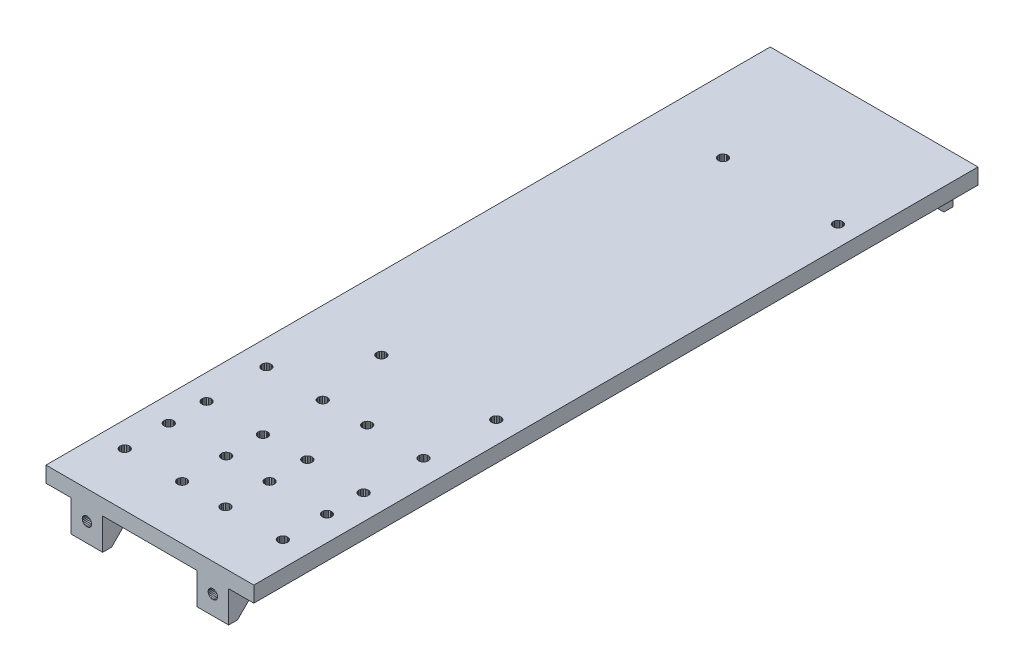
from build123d import *

# Parameters (mm, degrees)
SKETCH1_W           = 65.999999642
SKETCH1_H           = 229.999999516
BOSS_EXTRUDE1_DEPTH = 4.999999888
CUT_EXTRUDE1_DEPTH  = 238.358378211
CUT_EXTRUDE2_DEPTH  = 238.358378211
CUT_EXTRUDE3_DEPTH  = 238.358378211
CUT_EXTRUDE4_DEPTH  = 238.358378211
CUT_EXTRUDE5_DEPTH  = 238.358378211
CUT_EXTRUDE6_DEPTH  = 238.358378211
CUT_EXTRUDE7_DEPTH  = 238.358378211
CUT_EXTRUDE8_DEPTH  = 238.358378211
CUT_EXTRUDE9_DEPTH  = 238.358378211
CUT_EXTRUDE10_DEPTH = 238.358378211
CUT_EXTRUDE11_DEPTH = 238.358378211
CUT_EXTRUDE12_DEPTH = 238.358378211
CUT_EXTRUDE13_DEPTH = 238.358378211
CUT_EXTRUDE14_DEPTH = 238.358378211
CUT_EXTRUDE15_DEPTH = 238.358378211
CUT_EXTRUDE16_DEPTH = 238.358378211
CUT_EXTRUDE17_DEPTH = 238.358378211
CUT_EXTRUDE18_DEPTH = 238.358378211
CUT_EXTRUDE19_DEPTH = 238.358378211
SKETCH21_W          = 10.000000708
SKETCH21_H          = 10.000005364
BOSS_EXTRUDE2_DEPTH = 9.999999776
CUT_EXTRUDE20_DEPTH = 223.966359357
SKETCH23_W          = 10.000000708
SKETCH23_H          = 9.999999777
BOSS_EXTRUDE3_DEPTH = 9.999999776
CUT_EXTRUDE21_DEPTH = 223.96636487
SKETCH25_W          = 10.000000708
SKETCH25_H          = 10.000005364
BOSS_EXTRUDE4_DEPTH = 9.999999776
CUT_EXTRUDE22_DEPTH = 223.966359357
CUT_EXTRUDE23_DEPTH = 238.516314605
SKETCH28_W          = 10.000000708
SKETCH28_H          = 9.999999777
BOSS_EXTRUDE5_DEPTH = 9.999999776
CUT_EXTRUDE24_REACH = 234.839
CUT_EXTRUDE25_DEPTH = 243.515978303
CUT_EXTRUDE26_DEPTH = 243.515978303


with BuildPart() as part:
    # Sketch1 → Boss-Extrude1 (new body)
    with BuildSketch(Plane(origin=(0, 0, 0), x_dir=(1, 0, 0), z_dir=(0, 1, 0))):
        with Locations((0, -119.999999646)):
            Rectangle(SKETCH1_W, SKETCH1_H)
    extrude(amount=-BOSS_EXTRUDE1_DEPTH)

    # Sketch2 → Cut-Extrude1 (cut, through all)
    with BuildSketch(Plane.XZ.offset(4.999999888)):
        Polygon((-8.432590403, 192.175418139), (-8.38147942, 191.787183285), (-8.231628686, 191.425412893), (-7.993251085, 191.114768386), (-7.682590745, 190.876379609), (-7.320819888, 190.726533532), (-6.932591554, 190.675407648), (-6.544363685, 190.726533532), (-6.182592362, 190.876379609), (-5.871932488, 191.114768386), (-5.633554887, 191.425412893), (-5.483704153, 191.787183285), (-5.432592705, 192.175418139), (-5.483704153, 192.563638091), (-5.633554887, 192.925408483), (-5.871932488, 193.236067891), (-6.182592362, 193.474456668), (-6.544363685, 193.624302745), (-6.932591554, 193.675413728), (-7.320819888, 193.624302745), (-7.682590745, 193.474456668), (-7.993251085, 193.236067891), (-8.231628686, 192.925408483), (-8.38147942, 192.563638091), align=None)
    extrude(amount=-CUT_EXTRUDE1_DEPTH, mode=Mode.SUBTRACT)

    # Sketch3 → Cut-Extrude2 (cut, through all)
    with BuildSketch(Plane.XZ.offset(4.999999888)):
        Polygon((-8.373498917, 203.901484609), (-8.322387934, 203.513264656), (-8.172538131, 203.151494265), (-7.934159599, 202.840834856), (-7.623499259, 202.602446079), (-7.261727937, 202.452600002), (-6.873499602, 202.401489019), (-6.485270336, 202.452600002), (-6.123499479, 202.602446079), (-5.812839139, 202.840834856), (-5.574461073, 203.151494265), (-5.424610805, 203.513264656), (-5.373499356, 203.901484609), (-5.424610805, 204.289719462), (-5.574461073, 204.651489854), (-5.812839139, 204.962149262), (-6.123499479, 205.200538039), (-6.485270336, 205.350369215), (-6.873499602, 205.401495099), (-7.261727937, 205.350369215), (-7.623499259, 205.200538039), (-7.934159599, 204.962149262), (-8.172538131, 204.651489854), (-8.322387934, 204.289719462), align=None)
    extrude(amount=-CUT_EXTRUDE2_DEPTH, mode=Mode.SUBTRACT)

    # Sketch4 → Cut-Extrude3 (cut, through all)
    with BuildSketch(Plane.XZ.offset(4.999999888)):
        Polygon((-26.448886842, 191.611766815), (-26.299037039, 191.249996424), (-26.060659438, 190.939351916), (-25.75000003, 190.700978041), (-25.388229638, 190.551117063), (-25.000000373, 190.50000608), (-24.611772969, 190.551117063), (-24.250002578, 190.700978041), (-23.939341307, 190.939351916), (-23.700963706, 191.249996424), (-23.551113904, 191.611766815), (-23.500001058, 192.000001669), (-23.551113904, 192.388236523), (-23.700963706, 192.750006914), (-23.939341307, 193.060666323), (-24.250002578, 193.299040198), (-24.611772969, 193.448886275), (-25.000000373, 193.499997258), (-25.388229638, 193.448886275), (-25.75000003, 193.299040198), (-26.060659438, 193.060666323), (-26.299037039, 192.750006914), (-26.448886842, 192.388236523), (-26.499997824, 192.000001669), align=None)
    extrude(amount=-CUT_EXTRUDE3_DEPTH, mode=Mode.SUBTRACT)

    # Sketch5 → Cut-Extrude4 (cut, through all)
    with BuildSketch(Plane.XZ.offset(4.999999888)):
        Polygon((-24.611771107, 205.448895693), (-25.000000373, 205.500006676), (-25.388229638, 205.448895693), (-25.75000003, 205.299034715), (-26.060659438, 205.06067574), (-26.299037039, 204.750001431), (-26.448888704, 204.388231039), (-26.499999687, 203.999996185), (-26.448888704, 203.611776233), (-26.299037039, 203.250005841), (-26.060659438, 202.939346433), (-25.75000003, 202.700957656), (-25.388229638, 202.551111579), (-25.000000373, 202.500000596), (-24.611771107, 202.551111579), (-24.250000715, 202.700957656), (-23.939341307, 202.939346433), (-23.700961843, 203.250005841), (-23.551112041, 203.611776233), (-23.499999195, 203.999996185), (-23.551112041, 204.388231039), (-23.700961843, 204.750001431), (-23.939341307, 205.06067574), (-24.250000715, 205.299034715), align=None)
    extrude(amount=-CUT_EXTRUDE4_DEPTH, mode=Mode.SUBTRACT)

    # Sketch6 → Cut-Extrude5 (cut, through all)
    with BuildSketch(Plane.XZ.offset(4.999999888)):
        Polygon((-7.934158668, 216.840833426), (-7.623498794, 216.602444649), (-7.261727937, 216.452613473), (-6.873499602, 216.401487589), (-6.485271268, 216.452613473), (-6.12350041, 216.602444649), (-5.812840536, 216.840833426), (-5.574462935, 217.151492834), (-5.424612667, 217.513263226), (-5.373501219, 217.901483178), (-5.424612667, 218.289718032), (-5.574462935, 218.651488423), (-5.812840536, 218.962147832), (-6.12350041, 219.200536609), (-6.485271268, 219.350367785), (-6.873499602, 219.401493669), (-7.261727937, 219.350367785), (-7.623498794, 219.200536609), (-7.934158668, 218.962147832), (-8.172536269, 218.651488423), (-8.322387002, 218.289718032), (-8.373497985, 217.901483178), (-8.322387002, 217.513263226), (-8.172536269, 217.151492834), align=None)
    extrude(amount=-CUT_EXTRUDE5_DEPTH, mode=Mode.SUBTRACT)

    # Sketch7 → Cut-Extrude6 (cut, through all)
    with BuildSketch(Plane.XZ.offset(4.999999888)):
        Polygon((-8.381480351, 172.787189484), (-8.231629618, 172.425419092), (-7.993251085, 172.114744782), (-7.682591211, 171.876370907), (-7.320819888, 171.726509929), (-6.932591554, 171.675413847), (-6.544362754, 171.726509929), (-6.182591431, 171.876370907), (-5.871931091, 172.114744782), (-5.633553024, 172.425419092), (-5.483702756, 172.787189484), (-5.432591308, 173.175409436), (-5.483702756, 173.56364429), (-5.633553024, 173.925414681), (-5.871931091, 174.23607409), (-6.182591431, 174.474462867), (-6.544362754, 174.624294043), (-6.932591554, 174.675419927), (-7.320819888, 174.624294043), (-7.682591211, 174.474462867), (-7.993251085, 174.23607409), (-8.231629618, 173.925414681), (-8.381480351, 173.56364429), (-8.432591334, 173.175409436), align=None)
    extrude(amount=-CUT_EXTRUDE6_DEPTH, mode=Mode.SUBTRACT)

    # Sketch8 → Cut-Extrude7 (cut, through all)
    with BuildSketch(Plane.XZ.offset(4.999999888)):
        Polygon((-24.250002578, 216.700971127), (-23.939341307, 216.939345002), (-23.700963706, 217.250004411), (-23.551113904, 217.611774802), (-23.500001058, 217.999994755), (-23.551113904, 218.388229609), (-23.700963706, 218.75), (-23.939341307, 219.06067431), (-24.250002578, 219.299048185), (-24.611772969, 219.448879361), (-25.000000373, 219.500005245), (-25.388229638, 219.448879361), (-25.75000003, 219.299048185), (-26.060659438, 219.06067431), (-26.299037039, 218.75), (-26.448886842, 218.388229609), (-26.499997824, 217.999994755), (-26.448886842, 217.611774802), (-26.299037039, 217.250004411), (-26.060659438, 216.939345002), (-25.75000003, 216.700971127), (-25.388229638, 216.551110148), (-25.000000373, 216.499999166), (-24.611772969, 216.551110148), align=None)
    extrude(amount=-CUT_EXTRUDE7_DEPTH, mode=Mode.SUBTRACT)

    # Sketch9 → Cut-Extrude8 (cut, through all)
    with BuildSketch(Plane.XZ.offset(4.999999888)):
        Polygon((5.551111419, 203.611776233), (5.700962152, 203.250005841), (5.939340219, 202.939346433), (6.250000093, 202.700957656), (6.611771416, 202.551111579), (7.000000216, 202.500000596), (7.388229016, 202.551111579), (7.749999873, 202.700957656), (8.060660213, 202.939346433), (8.299037814, 203.250005841), (8.448888548, 203.611776233), (8.500000462, 203.999996185), (8.448888548, 204.388231039), (8.299037814, 204.750001431), (8.060660213, 205.060660839), (7.749999873, 205.299034715), (7.388229016, 205.448880792), (7.000000216, 205.500006676), (6.611771416, 205.448880792), (6.250000093, 205.299034715), (5.939340219, 205.060660839), (5.700962152, 204.750001431), (5.551111419, 204.388231039), (5.49999997, 203.999996185), align=None)
    extrude(amount=-CUT_EXTRUDE8_DEPTH, mode=Mode.SUBTRACT)

    # Sketch10 → Cut-Extrude9 (cut, through all)
    with BuildSketch(Plane.XZ.offset(4.999999888)):
        Polygon((5.700962152, 172.250002623), (5.939340219, 171.939343214), (6.250000093, 171.700954437), (6.611771416, 171.551123261), (7.000000216, 171.499997377), (7.388229016, 171.551123261), (7.749999873, 171.700954437), (8.060660213, 171.939343214), (8.299037814, 172.250002623), (8.448888548, 172.611773014), (8.500000462, 172.999992967), (8.448888548, 173.38822782), (8.299037814, 173.749998212), (8.060660213, 174.060672522), (7.749999873, 174.299046397), (7.388229016, 174.448892474), (7.000000216, 174.500003457), (6.611771416, 174.448892474), (6.250000093, 174.299046397), (5.939340219, 174.060672522), (5.700962152, 173.749998212), (5.551111419, 173.38822782), (5.49999997, 172.999992967), (5.551111419, 172.611773014), align=None)
    extrude(amount=-CUT_EXTRUDE9_DEPTH, mode=Mode.SUBTRACT)

    # Sketch11 → Cut-Extrude10 (cut, through all)
    with BuildSketch(Plane.XZ.offset(4.999999888)):
        Polygon((5.551112816, 191.611766815), (5.700963084, 191.249996424), (5.93934115, 190.939351916), (6.250001024, 190.700978041), (6.611771882, 190.551117063), (7.000000216, 190.50000608), (7.388228551, 190.551117063), (7.749999408, 190.700978041), (8.060659282, 190.939351916), (8.299036883, 191.249996424), (8.448887616, 191.611766815), (8.499998599, 192.000001669), (8.448887616, 192.388236523), (8.299036883, 192.750006914), (8.060659282, 193.060666323), (7.749999408, 193.299040198), (7.388228551, 193.448886275), (7.000000216, 193.499997258), (6.611771882, 193.448886275), (6.250001024, 193.299040198), (5.93934115, 193.060666323), (5.700963084, 192.750006914), (5.551112816, 192.388236523), (5.500001367, 192.000001669), align=None)
    extrude(amount=-CUT_EXTRUDE10_DEPTH, mode=Mode.SUBTRACT)

    # Sketch12 → Cut-Extrude11 (cut, through all)
    with BuildSketch(Plane.XZ.offset(4.999999888)):
        Polygon((8.500000462, 217.999994755), (8.448888548, 218.388229609), (8.299037814, 218.75), (8.060660213, 219.060659409), (7.749999873, 219.299048185), (7.388228551, 219.448879361), (7.000000216, 219.500005245), (6.611771416, 219.448879361), (6.250000093, 219.299048185), (5.939339753, 219.060659409), (5.700962152, 218.75), (5.551111419, 218.388229609), (5.49999997, 217.999994755), (5.551111419, 217.611774802), (5.700962152, 217.250004411), (5.939339753, 216.939345002), (6.250000093, 216.700956225), (6.611771416, 216.551110148), (7.000000216, 216.499999166), (7.388228551, 216.551110148), (7.749999873, 216.700956225), (8.060660213, 216.939345002), (8.299037814, 217.250004411), (8.448888548, 217.611774802), align=None)
    extrude(amount=-CUT_EXTRUDE11_DEPTH, mode=Mode.SUBTRACT)

    # Sketch13 → Cut-Extrude12 (cut, through all)
    with BuildSketch(Plane.XZ.offset(4.999999888)):
        Polygon((-23.551112041, 173.38822782), (-23.700961843, 173.749998212), (-23.939341307, 174.06065762), (-24.250000715, 174.299046397), (-24.611771107, 174.448877573), (-25.000000373, 174.500003457), (-25.388229638, 174.448877573), (-25.75000003, 174.299046397), (-26.060659438, 174.06065762), (-26.299037039, 173.749998212), (-26.448888704, 173.38822782), (-26.499999687, 172.999992967), (-26.448888704, 172.611773014), (-26.299037039, 172.250002623), (-26.060659438, 171.939343214), (-25.75000003, 171.700954437), (-25.388229638, 171.551123261), (-25.000000373, 171.499997377), (-24.611771107, 171.551123261), (-24.250000715, 171.700954437), (-23.939341307, 171.939343214), (-23.700961843, 172.250002623), (-23.551112041, 172.611773014), (-23.499999195, 172.999992967), align=None)
    extrude(amount=-CUT_EXTRUDE12_DEPTH, mode=Mode.SUBTRACT)

    # Sketch14 → Cut-Extrude13 (cut, through all)
    with BuildSketch(Plane.XZ.offset(4.999999888)):
        Polygon((-11.500000022, 43.00000146), (-11.448889039, 42.611770332), (-11.299038306, 42.24999994), (-11.060660705, 41.939340532), (-10.750000365, 41.700962931), (-10.388228111, 41.551113129), (-9.999999776, 41.49999842), (-9.611771442, 41.551113129), (-9.250000119, 41.700962931), (-8.939339779, 41.939340532), (-8.700962178, 42.24999994), (-8.551111445, 42.611770332), (-8.500000462, 43.00000146), (-8.551111445, 43.388228863), (-8.700962178, 43.749999255), (-8.939339779, 44.060662389), (-9.250000119, 44.299036264), (-9.611771442, 44.448886067), (-9.999999776, 44.500000775), (-10.388228111, 44.448886067), (-10.750000365, 44.299036264), (-11.060660705, 44.060662389), (-11.299038306, 43.749999255), (-11.448889039, 43.388228863), align=None)
    extrude(amount=-CUT_EXTRUDE13_DEPTH, mode=Mode.SUBTRACT)

    # Sketch15 → Cut-Extrude14 (cut, through all)
    with BuildSketch(Plane.XZ.offset(4.999999888)):
        Polygon((23.827463388, 203.151494265), (24.065839127, 202.840819955), (24.376500398, 202.602446079), (24.738270789, 202.452585101), (25.126501918, 202.401489019), (25.514729321, 202.452585101), (25.876501575, 202.602446079), (26.187160984, 202.840819955), (26.425538585, 203.151494265), (26.575390249, 203.513264656), (26.626501232, 203.901484609), (26.575390249, 204.289719462), (26.425538585, 204.651489854), (26.187160984, 204.962149262), (25.876501575, 205.200538039), (25.514729321, 205.350369215), (25.126501918, 205.401495099), (24.738270789, 205.350369215), (24.376500398, 205.200538039), (24.065839127, 204.962149262), (23.827463388, 204.651489854), (23.677611724, 204.289719462), (23.626500741, 203.901484609), (23.677611724, 203.513264656), align=None)
    extrude(amount=-CUT_EXTRUDE14_DEPTH, mode=Mode.SUBTRACT)

    # Sketch16 → Cut-Extrude15 (cut, through all)
    with BuildSketch(Plane.XZ.offset(4.999999888)):
        Polygon((23.677611724, 217.513263226), (23.827463388, 217.151492834), (24.065839127, 216.840818524), (24.376500398, 216.602444649), (24.738270789, 216.452583671), (25.126501918, 216.401487589), (25.514729321, 216.452583671), (25.876501575, 216.602444649), (26.187160984, 216.840818524), (26.425538585, 217.151492834), (26.575390249, 217.513263226), (26.626501232, 217.901483178), (26.575390249, 218.289718032), (26.425538585, 218.651488423), (26.187160984, 218.962147832), (25.876501575, 219.200536609), (25.514729321, 219.350367785), (25.126501918, 219.401493669), (24.738270789, 219.350367785), (24.376500398, 219.200536609), (24.065839127, 218.962147832), (23.827463388, 218.651488423), (23.677611724, 218.289718032), (23.626500741, 217.901483178), align=None)
    extrude(amount=-CUT_EXTRUDE15_DEPTH, mode=Mode.SUBTRACT)

    # Sketch17 → Cut-Extrude16 (cut, through all)
    with BuildSketch(Plane.XZ.offset(4.999999888)):
        Polygon((-8.551111445, 151.888236403), (-8.700962178, 152.250006795), (-8.939339779, 152.560651302), (-9.250000119, 152.799040079), (-9.611771442, 152.948886156), (-9.999999776, 152.999997139), (-10.388228111, 152.948886156), (-10.750000365, 152.799040079), (-11.060660705, 152.560651302), (-11.299038306, 152.250006795), (-11.448889039, 151.888236403), (-11.500000022, 151.50000155), (-11.448889039, 151.111766696), (-11.299038306, 150.749996305), (-11.060660705, 150.439351797), (-10.750000365, 150.20096302), (-10.388228111, 150.051116943), (-9.999999776, 150.00000596), (-9.611771442, 150.051116943), (-9.250000119, 150.20096302), (-8.939339779, 150.439351797), (-8.700962178, 150.749996305), (-8.551111445, 151.111766696), (-8.500000462, 151.50000155), align=None)
    extrude(amount=-CUT_EXTRUDE16_DEPTH, mode=Mode.SUBTRACT)

    # Sketch18 → Cut-Extrude17 (cut, through all)
    with BuildSketch(Plane.XZ.offset(4.999999888)):
        Polygon((23.618521169, 191.787183285), (23.768370971, 191.425412893), (24.006748572, 191.114768386), (24.317409843, 190.876379609), (24.679180235, 190.726533532), (25.0674095, 190.675407648), (25.455636904, 190.726533532), (25.817409158, 190.876379609), (26.128068566, 191.114768386), (26.36644803, 191.425412893), (26.516297832, 191.787183285), (26.567408815, 192.175418139), (26.516297832, 192.563638091), (26.36644803, 192.925408483), (26.128068566, 193.236067891), (25.817409158, 193.474456668), (25.455636904, 193.624302745), (25.0674095, 193.675413728), (24.679180235, 193.624302745), (24.317409843, 193.474456668), (24.006748572, 193.236067891), (23.768370971, 192.925408483), (23.618521169, 192.563638091), (23.567410186, 192.175418139), align=None)
    extrude(amount=-CUT_EXTRUDE17_DEPTH, mode=Mode.SUBTRACT)

    # Sketch19 → Cut-Extrude18 (cut, through all)
    with BuildSketch(Plane.XZ.offset(4.999999888)):
        Polygon((24.700962007, 150.250002742), (24.939341471, 149.939343333), (25.250000879, 149.700954556), (25.611771271, 149.551123381), (26.000000536, 149.499997497), (26.388229802, 149.551123381), (26.750000194, 149.700954556), (27.060659602, 149.939343333), (27.299037203, 150.250002742), (27.448888868, 150.611773133), (27.499999851, 150.999993086), (27.448888868, 151.38822794), (27.299037203, 151.749998331), (27.060659602, 152.06065774), (26.750000194, 152.299046516), (26.388229802, 152.448877692), (26.000000536, 152.500003576), (25.611771271, 152.448877692), (25.250000879, 152.299046516), (24.939341471, 152.06065774), (24.700962007, 151.749998331), (24.551110342, 151.38822794), (24.499999359, 150.999993086), (24.551110342, 150.611773133), align=None)
    extrude(amount=-CUT_EXTRUDE18_DEPTH, mode=Mode.SUBTRACT)

    # Sketch20 → Cut-Extrude19 (cut, through all)
    with BuildSketch(Plane.XZ.offset(4.999999888)):
        Polygon((25.000000373, 43.00000146), (25.051111355, 42.611770332), (25.200961158, 42.24999994), (25.439340621, 41.939340532), (25.75000003, 41.700962931), (26.111770421, 41.551113129), (26.499999687, 41.49999842), (26.888228953, 41.551113129), (27.249999344, 41.700962931), (27.560658753, 41.939340532), (27.799038216, 42.24999994), (27.948888019, 42.611770332), (28.000000864, 43.00000146), (27.948888019, 43.388228863), (27.799038216, 43.749999255), (27.560658753, 44.060662389), (27.249999344, 44.299036264), (26.888228953, 44.448886067), (26.499999687, 44.500000775), (26.111770421, 44.448886067), (25.75000003, 44.299036264), (25.439340621, 44.060662389), (25.200961158, 43.749999255), (25.051111355, 43.388228863), align=None)
    extrude(amount=-CUT_EXTRUDE19_DEPTH, mode=Mode.SUBTRACT)

    # Sketch21 → Boss-Extrude2 (add)
    with BuildSketch(Plane.XZ.offset(4.999999888)):
        with Locations((-20.000000019, 229.999996722)):
            Rectangle(SKETCH21_W, SKETCH21_H)
    extrude(amount=BOSS_EXTRUDE2_DEPTH)

    # Sketch22 → Cut-Extrude20 (cut, through all)
    with BuildSketch(Plane(origin=(0, 0, 224.99999404), x_dir=(-1, 0, 0), z_dir=(0, 0, -1))):
        Polygon((18.939340487, -7.939339615), (18.700962886, -8.249999955), (18.551111221, -8.611771278), (18.500000238, -8.999999613), (18.551111221, -9.388228878), (18.700962886, -9.750000201), (18.939340487, -10.060660541), (19.249999896, -10.299038142), (19.611770287, -10.448888876), (19.999999553, -10.499999858), (20.388228819, -10.448888876), (20.74999921, -10.299038142), (21.060658619, -10.060660541), (21.299038082, -9.750000201), (21.448887885, -9.388228878), (21.50000073, -8.999999613), (21.448887885, -8.611771278), (21.299038082, -8.249999955), (21.060658619, -7.939339615), (20.74999921, -7.700962014), (20.388228819, -7.551111281), (19.999999553, -7.499999832), (19.611770287, -7.551111281), (19.249999896, -7.700962014), align=None)
    extrude(amount=-CUT_EXTRUDE20_DEPTH, mode=Mode.SUBTRACT)

    # Sketch23 → Boss-Extrude3 (add)
    with BuildSketch(Plane.XZ.offset(4.999999888)):
        with Locations((-20.000000019, 9.999999777)):
            Rectangle(SKETCH23_W, SKETCH23_H)
    extrude(amount=BOSS_EXTRUDE3_DEPTH)

    # Sketch24 → Cut-Extrude21 (cut, through all)
    with BuildSketch(Plane.XY.offset(14.999999665)):
        Polygon((-18.500000238, -8.999999613), (-18.551111221, -8.611771278), (-18.700962886, -8.249999955), (-18.939340487, -7.939339615), (-19.249999896, -7.700962014), (-19.611770287, -7.551111281), (-19.999999553, -7.499999832), (-20.388228819, -7.551111281), (-20.74999921, -7.700962014), (-21.060658619, -7.939339615), (-21.299038082, -8.249999955), (-21.448887885, -8.611771278), (-21.50000073, -8.999999613), (-21.448887885, -9.388228878), (-21.299038082, -9.750000201), (-21.060658619, -10.060660541), (-20.74999921, -10.299038142), (-20.388228819, -10.448888876), (-19.999999553, -10.499999858), (-19.611770287, -10.448888876), (-19.249999896, -10.299038142), (-18.939340487, -10.060660541), (-18.700962886, -9.750000201), (-18.551111221, -9.388228878), align=None)
    extrude(amount=-CUT_EXTRUDE21_DEPTH, mode=Mode.SUBTRACT)

    # Sketch25 → Boss-Extrude4 (add)
    with BuildSketch(Plane.XZ.offset(4.999999888)):
        with Locations((20.000000019, 229.999996722)):
            Rectangle(SKETCH25_W, SKETCH25_H)
    extrude(amount=BOSS_EXTRUDE4_DEPTH)

    # Sketch26 → Cut-Extrude22 (cut, through all)
    with BuildSketch(Plane(origin=(0, 0, 224.99999404), x_dir=(-1, 0, 0), z_dir=(0, 0, -1))):
        Polygon((-20.74999921, -10.299038142), (-20.388228819, -10.448888876), (-19.999999553, -10.499999858), (-19.611770287, -10.448888876), (-19.249999896, -10.299038142), (-18.939340487, -10.060660541), (-18.700962886, -9.750000201), (-18.551111221, -9.388228878), (-18.500000238, -8.999999613), (-18.551111221, -8.611771278), (-18.700962886, -8.249999955), (-18.939340487, -7.939339615), (-19.249999896, -7.700962014), (-19.611770287, -7.551111281), (-19.999999553, -7.499999832), (-20.388228819, -7.551111281), (-20.74999921, -7.700962014), (-21.060658619, -7.939339615), (-21.299038082, -8.249999955), (-21.448887885, -8.611771278), (-21.50000073, -8.999999613), (-21.448887885, -9.388228878), (-21.299038082, -9.750000201), (-21.060658619, -10.060660541), align=None)
    extrude(amount=-CUT_EXTRUDE22_DEPTH, mode=Mode.SUBTRACT)

    # Sketch27 → Cut-Extrude23 (cut, through all)
    with BuildSketch(Plane.XZ.offset(4.999999888)):
        Polygon((23.618521169, 172.787189484), (23.768370971, 172.425419092), (24.006748572, 172.114759684), (24.317409843, 171.876370907), (24.679180235, 171.72652483), (25.0674095, 171.675413847), (25.455636904, 171.72652483), (25.817409158, 171.876370907), (26.128068566, 172.114759684), (26.36644803, 172.425419092), (26.516297832, 172.787189484), (26.567408815, 173.175409436), (26.516297832, 173.56364429), (26.36644803, 173.925414681), (26.128068566, 174.23607409), (25.817409158, 174.474462867), (25.455636904, 174.624294043), (25.0674095, 174.675419927), (24.679180235, 174.624294043), (24.317409843, 174.474462867), (24.006748572, 174.23607409), (23.768370971, 173.925414681), (23.618521169, 173.56364429), (23.567410186, 173.175409436), align=None)
    extrude(amount=-CUT_EXTRUDE23_DEPTH, mode=Mode.SUBTRACT)

    # Sketch28 → Boss-Extrude5 (add)
    with BuildSketch(Plane.XZ.offset(4.999999888)):
        with Locations((20.000000019, 9.999999777)):
            Rectangle(SKETCH28_W, SKETCH28_H)
    extrude(amount=BOSS_EXTRUDE5_DEPTH)

    # Sketch29 → Cut-Extrude24 (cut, up to next)
    with BuildSketch(Plane(origin=(0, 0, 4.999999888), x_dir=(-1, 0, 0), z_dir=(0, 0, -1)), mode=Mode.PRIVATE) as cut_extrude24_sk1:
        Polygon((-20.74999921, -10.299038142), (-20.388228819, -10.448888876), (-19.999999553, -10.499999858), (-19.611770287, -10.448888876), (-19.249999896, -10.299038142), (-18.939340487, -10.060660541), (-18.700962886, -9.750000201), (-18.551111221, -9.388228878), (-18.500000238, -8.999999613), (-18.551111221, -8.611771278), (-18.700962886, -8.249999955), (-18.939340487, -7.939339615), (-19.249999896, -7.700962014), (-19.611770287, -7.551111281), (-19.999999553, -7.499999832), (-20.388228819, -7.551111281), (-20.74999921, -7.700962014), (-21.060658619, -7.939339615), (-21.299038082, -8.249999955), (-21.448887885, -8.611771278), (-21.50000073, -8.999999613), (-21.448887885, -9.388228878), (-21.299038082, -9.750000201), (-21.060658619, -10.060660541), align=None)
    cut_extrude24_tool1 = extrude(cut_extrude24_sk1.sketch, amount=-CUT_EXTRUDE24_REACH, mode=Mode.PRIVATE) & part.part
    add(cut_extrude24_tool1.solids().sort_by_distance((20, -9, 5))[0], mode=Mode.SUBTRACT)

    # Sketch30 → Cut-Extrude25 (cut, through all)
    with BuildSketch(Plane(origin=(25.000000373, 0, 0), x_dir=(0, 0, -1), z_dir=(1, 0, 0))):
        Polygon((-7.828427013, -14.999999665), (-14.999999665, -14.999999665), (-14.999999665, -7.828427013), align=None)
    extrude(amount=-CUT_EXTRUDE25_DEPTH, mode=Mode.SUBTRACT)

    # Sketch31 → Cut-Extrude26 (cut, through all)
    with BuildSketch(Plane(origin=(25.000000373, 0, 0), x_dir=(0, 0, -1), z_dir=(1, 0, 0))):
        Polygon((-224.99999404, -7.828426223), (-232.171571489, -14.999999665), (-224.99999404, -14.999999665), align=None)
    extrude(amount=-CUT_EXTRUDE26_DEPTH, mode=Mode.SUBTRACT)


solid = part.part
